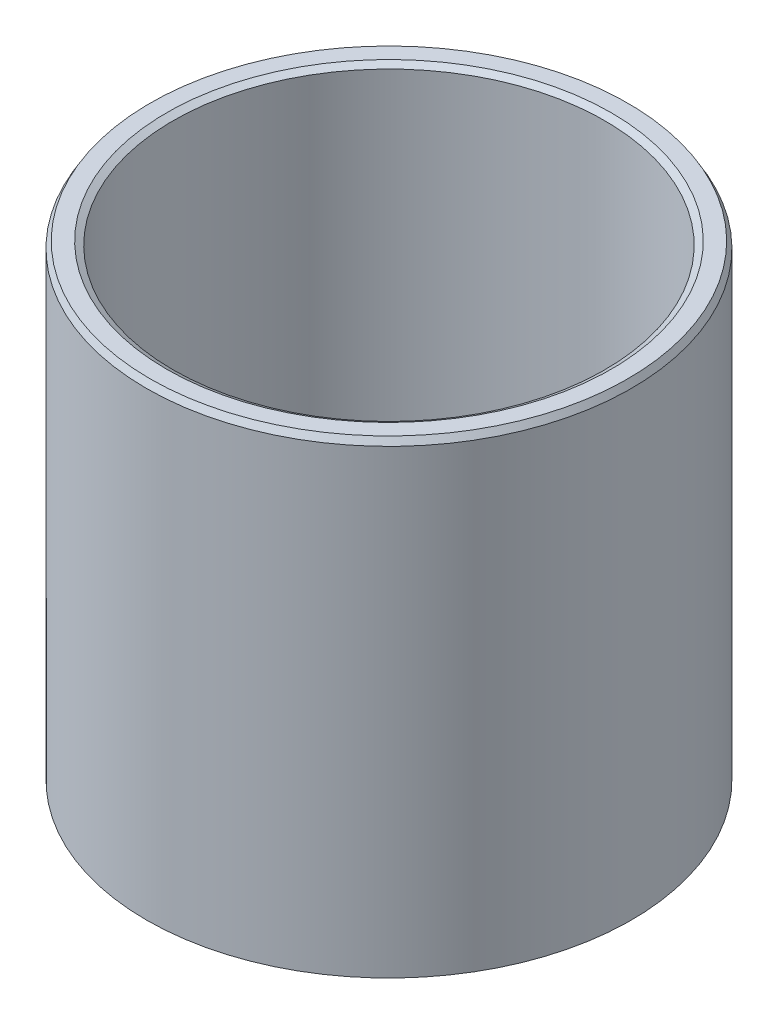
from build123d import *
from OCP.BRepFilletAPI import BRepFilletAPI_MakeChamfer

# Parameters (mm, degrees)
SKETCH1_R           = 55
BOSS_EXTRUDE1_DEPTH = 106.715641325
SKETCH2_R           = 48.948909521
CUT_EXTRUDE1_DEPTH  = 133.053883333
CHAMFER1_SIZE       = 1.455344471
CHAMFER1_SIZE2      = 0.840243522


with BuildPart() as part:
    # Sketch1 → Boss-Extrude1 (new body)
    with BuildSketch(Plane(origin=(0, 0, 0), x_dir=(1, 0, 0), z_dir=(0, 1, 0))):
        Circle(SKETCH1_R)
    extrude(amount=BOSS_EXTRUDE1_DEPTH)

    # Sketch2 → Cut-Extrude1 (cut, through all)
    with BuildSketch(Plane(origin=(0, 0, 0), x_dir=(1, 0, 0), z_dir=(0, 1, 0))):
        Circle(SKETCH2_R)
    extrude(amount=CUT_EXTRUDE1_DEPTH, mode=Mode.SUBTRACT)

    # Chamfer1: one chamfer whose edges measure the first distance from different faces: ONE call of the kernel's chamfer builder (chamfer() names one face for all edges)
    chamfer1_edges_1 = [part.edges().sort_by_distance(p)[0] for p in [
        (-48.948909521, 106.715641325, 0),
    ]]
    chamfer1_side_1 = [part.faces().sort_by_distance(p)[0] for p in [
        (-53.444365081, 106.715641325, 0),
    ]]
    chamfer1_edges_2 = [part.edges().sort_by_distance(p)[0] for p in [
        (-48.948909521, 0, 0),
    ]]
    chamfer1_side_2 = [part.faces().sort_by_distance(p)[0] for p in [
        (-48.948909521, 53.357820662, 0),
    ]]
    chamfer1_edges_3 = [part.edges().sort_by_distance(p)[0] for p in [
        (-55, 0, 0),
    ]]
    chamfer1_side_3 = [part.faces().sort_by_distance(p)[0] for p in [
        (-53.444365081, 0, 0),
    ]]
    chamfer1_edges_4 = [part.edges().sort_by_distance(p)[0] for p in [
        (-55, 106.715641325, 0),
    ]]
    chamfer1_side_4 = [part.faces().sort_by_distance(p)[0] for p in [
        (-55, 53.357820662, 0),
    ]]
    chamfer1 = BRepFilletAPI_MakeChamfer(part.part.solid().wrapped)
    for e in chamfer1_edges_1:
        chamfer1.Add(CHAMFER1_SIZE, CHAMFER1_SIZE2, e.wrapped, chamfer1_side_1[0].wrapped)  # the first distance lies on this face
    for e in chamfer1_edges_2:
        chamfer1.Add(CHAMFER1_SIZE, CHAMFER1_SIZE2, e.wrapped, chamfer1_side_2[0].wrapped)  # the first distance lies on this face
    for e in chamfer1_edges_3:
        chamfer1.Add(CHAMFER1_SIZE, CHAMFER1_SIZE2, e.wrapped, chamfer1_side_3[0].wrapped)  # the first distance lies on this face
    for e in chamfer1_edges_4:
        chamfer1.Add(CHAMFER1_SIZE, CHAMFER1_SIZE2, e.wrapped, chamfer1_side_4[0].wrapped)  # the first distance lies on this face
    add(Compound.cast(chamfer1.Shape()), mode=Mode.REPLACE)


solid = part.part
